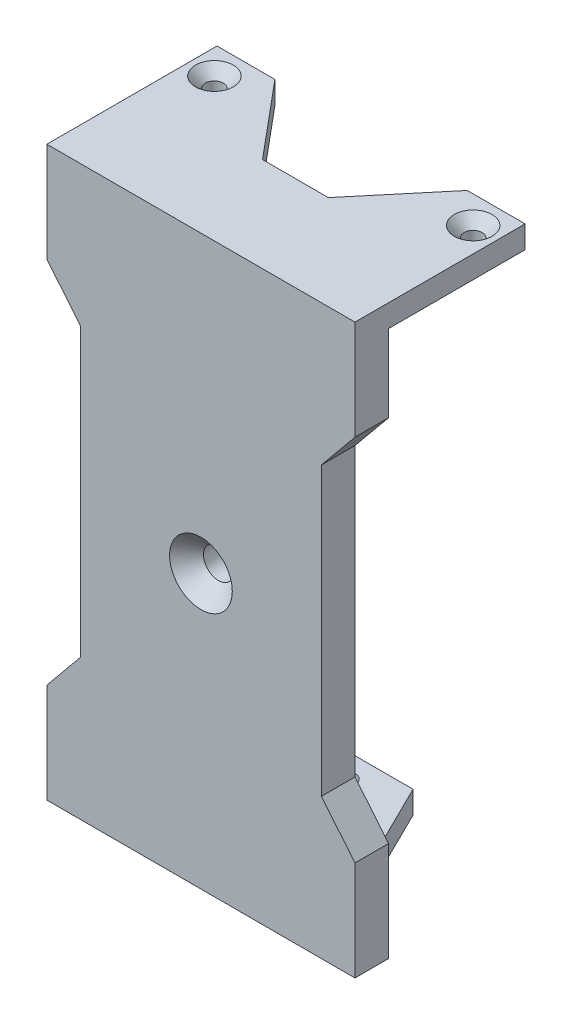
from build123d import *

# Parameters (mm, degrees)
BOSS_EXTRUDE1_DEPTH = 6
BOSS_EXTRUDE2_DEPTH = 4
BOSS_EXTRUDE3_DEPTH = 4
SKETCH4_R           = 2.7
CUT_EXTRUDE1_DEPTH  = 6
SKETCH6_R           = 5.6
SKETCH5_R           = 2.7
SKETCH7_R           = 1.6
CUT_EXTRUDE2_DEPTH  = 4
SKETCH8_R           = 1.6
CUT_EXTRUDE3_DEPTH  = 4
LPATTERN1_COUNT     = 2
LPATTERN1_PITCH     = 46.2


with BuildPart() as part:
    # Sketch1 → Boss-Extrude1 (new body)
    with BuildSketch(Plane.XY):
        Polygon((55, 0), (0, 0), (0, -13.787434686), (6, -21.083714938), (6, -72.316285062), (0, -79.612565314), (0, -93.4), (55, -93.4), (55, -79.612565314), (49, -72.316285062), (49, -21.083714938), (55, -13.787434686), align=None)
    extrude(amount=BOSS_EXTRUDE1_DEPTH)

    # Sketch2 → Boss-Extrude2 (add)
    with BuildSketch(Plane(origin=(0, 0, 0), x_dir=(1, 0, 0), z_dir=(0, 1, 0))):
        Polygon((0, -6), (0, 0), (0, 24.368247755), (10.336028335, 24.368247755), (21.625062203, 10.869324577), (33.374937797, 10.869324577), (44.663971665, 24.368247755), (55, 24.368247755), (55, 0), (55, -6), align=None)
    extrude(amount=BOSS_EXTRUDE2_DEPTH)

    # Sketch3 → Boss-Extrude3 (add)
    with BuildSketch(Plane.XZ.offset(93.4)):
        Polygon((55, 6), (0, 6), (0, 0), (7.974588669, 0), (20, -24.364916427), (35, -24.364916427), (47.025411331, 0), (55, 0), align=None)
    extrude(amount=BOSS_EXTRUDE3_DEPTH)

    # Sketch4 → Cut-Extrude1 (cut)
    with BuildSketch(Plane.XY.offset(6)):
        with Locations((27.5, -48.6)):
            Circle(SKETCH4_R)
    extrude(amount=-CUT_EXTRUDE1_DEPTH, mode=Mode.SUBTRACT)

    # Sketch6 → Cut-Loft1 section 0
    with BuildSketch(Plane.XY.offset(6)):
        with Locations((27.5, -48.6)):
            Circle(SKETCH6_R)
    # Sketch5 → Cut-Loft1 section 1
    with BuildSketch(Plane.XY.offset(2.85)):
        with Locations((27.5, -48.6)):
            Circle(SKETCH5_R)
    loft(mode=Mode.SUBTRACT)

    # Sketch7 → Cut-Extrude2 (cut)
    with BuildSketch(Plane(origin=(0, 4, 0), x_dir=(1, 0, 0), z_dir=(0, 1, 0))):
        with Locations(Location((50.6, 19.5, 0), (0, 0, 270))):
            Circle(SKETCH7_R)
        with Locations(Location((4.4, 19.5, 0), (0, 0, 270))):
            Circle(SKETCH7_R)
    extrude(amount=-CUT_EXTRUDE2_DEPTH, mode=Mode.SUBTRACT)

    # Sketch8 → Cut-Extrude3 (cut)
    with BuildSketch(Plane.XZ.offset(97.4)):
        with Locations(Location((27.5, -20, 0), (0, 0, 270))):
            Circle(SKETCH8_R)
    extrude(amount=-CUT_EXTRUDE3_DEPTH, mode=Mode.SUBTRACT)

    # Cut-Loft2: read off the stored shape, not the designer's step
    # Cut-Loft2: loft between two sections, ruled curve by curve
    cut_loft2_from = [
        Edge.make_bspline([(28.144905496, -97.4, -16.687188218), (34.77052906, -97.4, -17.97699921), (33.480718067, -97.4, -24.602622774), (26.855094504, -97.4, -23.312811782), (20.22947094, -97.4, -22.02300079), (21.519281933, -97.4, -15.397377226), (28.144905496, -97.4, -16.687188218)], [0, 0, 0, 0, 0.5, 0.5, 0.5, 1, 1, 1, 1], 3, [1, 0.333333333, 0.333333333, 1, 0.333333333, 0.333333333, 1]),
    ]
    cut_loft2_to = [
        Edge.make_bspline([(26.657155547, -95.5, -21.360004864), (23.93714582, -95.5, -19.674315958), (25.622834725, -95.5, -16.954306231), (28.342844453, -95.5, -18.639995136), (31.06285418, -95.5, -20.325684042), (29.377165275, -95.5, -23.045693769), (26.657155547, -95.5, -21.360004864)], [0, 0, 0, 0, 0.5, 0.5, 0.5, 1, 1, 1, 1], 3, [1, 0.333333333, 0.333333333, 1, 0.333333333, 0.333333333, 1]),
    ]
    cut_loft2 = Solid(Shell([*[Face.make_surface_from_curves(cut_loft2_from[k], cut_loft2_to[k]) for k in range(1)], Face(Wire(cut_loft2_from)), Face(Wire(cut_loft2_to))]))
    add(cut_loft2, mode=Mode.SUBTRACT)

    # Cut-Loft3: read off the stored shape, not the designer's step
    # Cut-Loft3: loft between two sections, ruled curve by curve
    cut_loft3_from = [
        Edge.make_bspline([(50.313932129, 4, -22.862854468), (57.039641066, 4, -23.434990209), (57.611776807, 4, -16.709281273), (50.886067871, 4, -16.137145532), (44.160358934, 4, -15.565009791), (43.588223193, 4, -22.290718727), (50.313932129, 4, -22.862854468)], [0, 0, 0, 0, 0.5, 0.5, 0.5, 1, 1, 1, 1], 3, [1, 0.333333333, 0.333333333, 1, 0.333333333, 0.333333333, 1]),
    ]
    cut_loft3_to = [
        Edge.make_bspline([(50.101749949, 2.1, -21.02044299), (53.14263593, 2.1, -22.016943092), (54.139136031, 2.1, -18.976057111), (51.098250051, 2.1, -17.97955701), (48.05736407, 2.1, -16.983056908), (47.060863969, 2.1, -20.023942889), (50.101749949, 2.1, -21.02044299)], [0, 0, 0, 0, 0.5, 0.5, 0.5, 1, 1, 1, 1], 3, [1, 0.333333333, 0.333333333, 1, 0.333333333, 0.333333333, 1]),
    ]
    cut_loft3 = Solid(Shell([*[Face.make_surface_from_curves(cut_loft3_from[k], cut_loft3_to[k]) for k in range(1)], Face(Wire(cut_loft3_from)), Face(Wire(cut_loft3_to))]))
    add(cut_loft3, mode=Mode.SUBTRACT)

    # LPattern1: Cut-Loft3 ×2
    with Locations(*[(-i * LPATTERN1_PITCH, 0, 0) for i in range(1, LPATTERN1_COUNT)]):
        add(cut_loft3, mode=Mode.SUBTRACT)


solid = part.part
